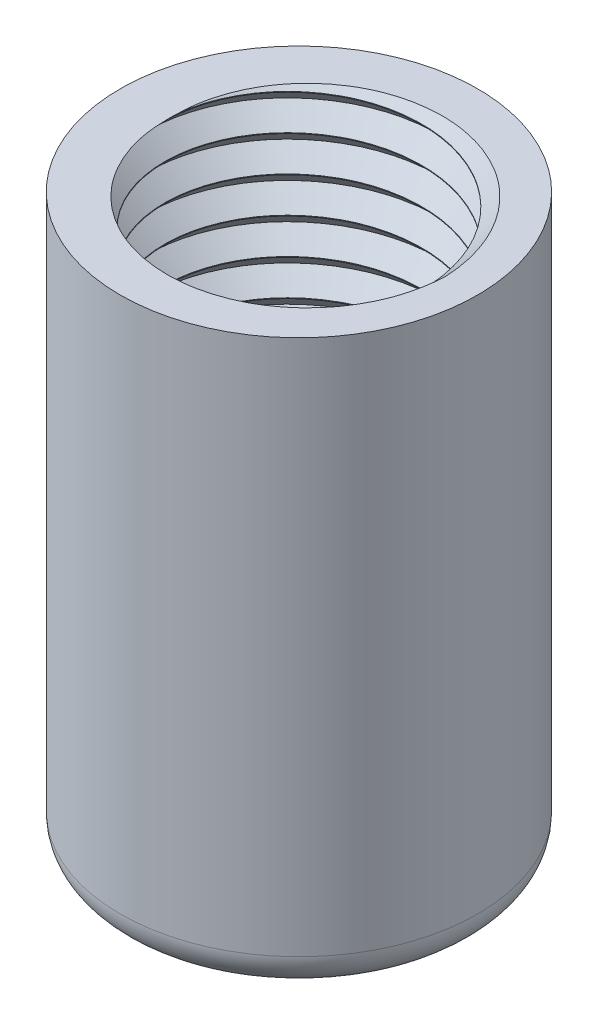
from build123d import *

# Parameters (mm, degrees)
ESQUISSE1_R                           = 25
BOSS_EXTRU_1_DEPTH                    = 80
COQUE1_T                              = -7
ENL_VEMENT_DE_MATI_RE_BALAYAGE1_PITCH = 5
ESQUISSE4_R                           = 7.5
ENL_V_MAT_EXTRU_1_DEPTH               = 7
CONG_1_R                              = 5


with BuildPart() as part:
    # Esquisse1 → Boss.-Extru.1 (new body)
    with BuildSketch(Plane(origin=(0, 0, 0), x_dir=(1, 0, 0), z_dir=(0, 1, 0))):
        with Locations(Location((0, 0, 0), (0, 0, 270))):
            Circle(ESQUISSE1_R)
    extrude(amount=BOSS_EXTRU_1_DEPTH)

    # Coque1
    coque1_openings = [part.faces().sort_by_distance(p)[0] for p in [
        (0, 80, 0),
    ]]
    offset(amount=COQUE1_T, openings=coque1_openings, kind=Kind.INTERSECTION)

    # Enlèvement de matière-Balayage1: arcs per turn and ends read off the stored shape
    # Enlèvement de matière-Balayage1: the profile of Esquisse3 profile screwed along a right-hand helix through 10 turns, 12 arcs to a turn; built about Z, then put on its axis
    enl_vement_de_mati_re_balayage1_z = Axis((0, 0, 0), (0, 0, 1))
    enl_vement_de_mati_re_balayage1_corners = [(17.9997, 0, -6.199783682), (17.9997, 0, -1.299195682), (20.5, 0, -3.75)]
    with BuildLine(mode=Mode.PRIVATE) as enl_vement_de_mati_re_balayage1_profile:
        Line(enl_vement_de_mati_re_balayage1_corners[0], enl_vement_de_mati_re_balayage1_corners[1])
        Line(enl_vement_de_mati_re_balayage1_corners[1], enl_vement_de_mati_re_balayage1_corners[2])
        Line(enl_vement_de_mati_re_balayage1_corners[2], enl_vement_de_mati_re_balayage1_corners[0])
    enl_vement_de_mati_re_balayage1_cap = Face(enl_vement_de_mati_re_balayage1_profile.wire())
    enl_vement_de_mati_re_balayage1_turn_angles = [0, 15, 30, 45, 60, 75, 90, 105, 120, 135, 150, 165, 180, 195, 210, 225, 240, 255, 270, 285, 300, 315, 330, 345, 360]
    enl_vement_de_mati_re_balayage1_turn_weights = [1, 0.9659258262890683, 1, 0.9659258262890683, 1, 0.9659258262890683, 1, 0.9659258262890683, 1, 0.9659258262890683, 1, 0.9659258262890683, 1, 0.9659258262890683, 1, 0.9659258262890683, 1, 0.9659258262890683, 1, 0.9659258262890683, 1, 0.9659258262890683, 1, 0.9659258262890683, 1]
    enl_vement_de_mati_re_balayage1_turn_rails = [Edge.make_bspline([Vector(p[0], p[1], 0).rotate(enl_vement_de_mati_re_balayage1_z, enl_vement_de_mati_re_balayage1_turn_angles[k]) / enl_vement_de_mati_re_balayage1_turn_weights[k] + Vector(0, 0, p[2] + ENL_VEMENT_DE_MATI_RE_BALAYAGE1_PITCH * enl_vement_de_mati_re_balayage1_turn_angles[k] / 360) for k in range(25)], [0, 0, 0, 1, 1, 2, 2, 3, 3, 4, 4, 5, 5, 6, 6, 7, 7, 8, 8, 9, 9, 10, 10, 11, 11, 12, 12, 12], 2, enl_vement_de_mati_re_balayage1_turn_weights) for p in enl_vement_de_mati_re_balayage1_corners]
    enl_vement_de_mati_re_balayage1_turn_sides = [Face.make_surface_from_curves(enl_vement_de_mati_re_balayage1_turn_rails[p[0]], enl_vement_de_mati_re_balayage1_turn_rails[p[1]]) for p in [(0, 1), (1, 2), (2, 0)]]
    enl_vement_de_mati_re_balayage1 = Plane(origin=(0, 80, 0), x_dir=(0, 0, 1), z_dir=(0, -1, 0)) * Solid(Shell([*[p.moved(Location((0, 0, ENL_VEMENT_DE_MATI_RE_BALAYAGE1_PITCH * i))) for i in range(10) for p in enl_vement_de_mati_re_balayage1_turn_sides], enl_vement_de_mati_re_balayage1_cap, enl_vement_de_mati_re_balayage1_cap.rotate(enl_vement_de_mati_re_balayage1_z, 3600).moved(Location((0, 0, ENL_VEMENT_DE_MATI_RE_BALAYAGE1_PITCH * 3600 / 360)))]))
    add(enl_vement_de_mati_re_balayage1, mode=Mode.SUBTRACT)

    # Esquisse4 → Enlèv. mat.-Extru.1 (cut)
    with BuildSketch(Plane(origin=(0, 7, 0), x_dir=(1, 0, 0), z_dir=(0, 1, 0))):
        with Locations(Location((0, 0, 0), (0, 0, 270))):
            Circle(ESQUISSE4_R)
    extrude(amount=-ENL_V_MAT_EXTRU_1_DEPTH, mode=Mode.SUBTRACT)

    # Congé1
    cong_1_edges = [part.edges().sort_by_distance(p)[0] for p in [
        (0, 0, -25),
    ]]
    fillet(cong_1_edges, radius=CONG_1_R)


solid = part.part
